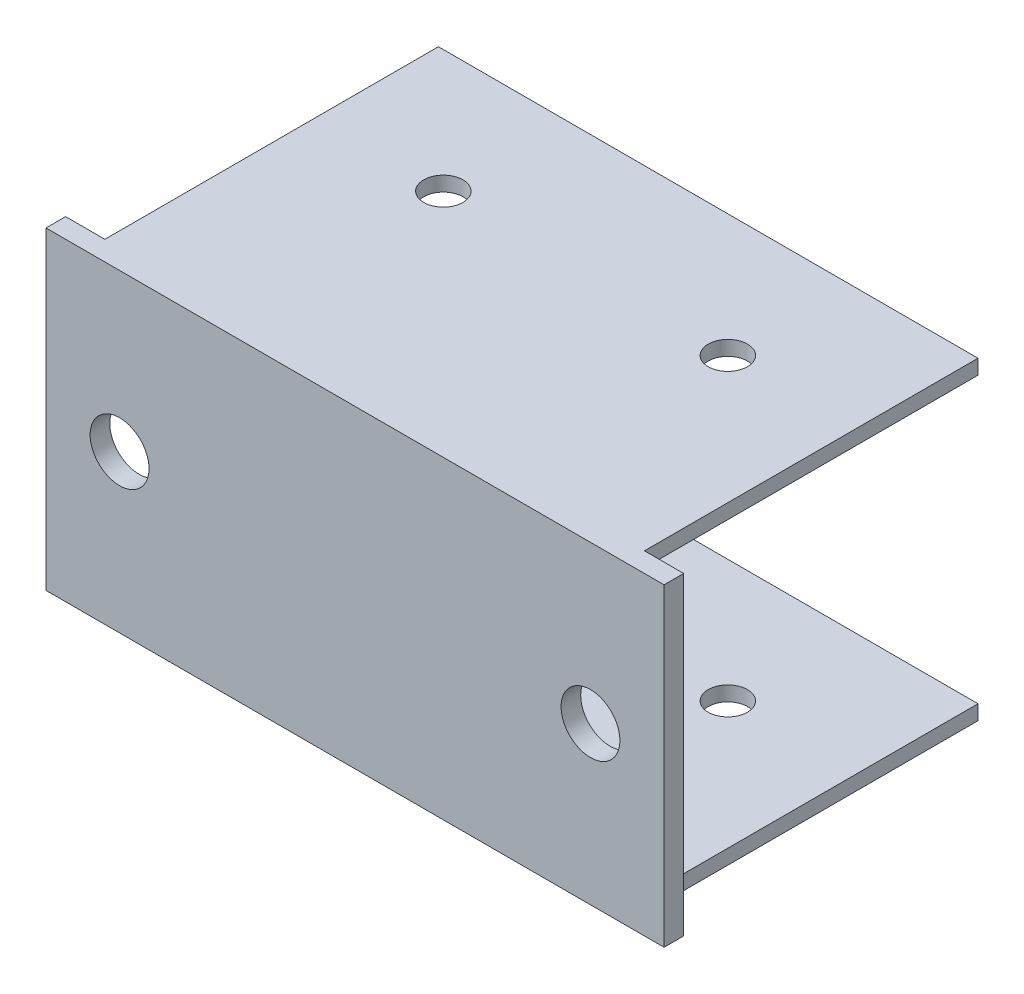
from build123d import *

# Parameters (mm, degrees)
SKETCH_1_W          = 63
SKETCH_1_H          = 32
EXTRUDE_1_DEPTH     = 2
SKETCH_2_R          = 3
CUT_EXTRUDE_1_DEPTH = 10
SKETCH_4_W          = 55
SKETCH_4_H          = 36
EXTRUDE_2_DEPTH     = 1.5
SKETCH_5_R          = 2
CUT_EXTRUDE_2_DEPTH = 57.322730758


with BuildPart() as part:
    # 草图1 → 凸台-拉伸1 (new body)
    with BuildSketch(Plane.XY):
        Rectangle(SKETCH_1_W, SKETCH_1_H)
    extrude(amount=EXTRUDE_1_DEPTH)

    # 草图2 → 切除-拉伸1 (cut)
    with BuildSketch(Plane.XY.offset(2)):
        with Locations((-24, 0)):
            Circle(SKETCH_2_R)
        with Locations((24, 0)):
            Circle(SKETCH_2_R)
    extrude(amount=-CUT_EXTRUDE_1_DEPTH, mode=Mode.SUBTRACT)

    # 草图4 → 凸台-拉伸2 (add)
    with BuildSketch(Plane(origin=(0, 16, 0), x_dir=(1, 0, 0), z_dir=(0, 1, 0))):
        with Locations((0, 16)):
            Rectangle(SKETCH_4_W, SKETCH_4_H)
    extrude_2 = extrude(amount=-EXTRUDE_2_DEPTH)

    # 草图5 → 切除-拉伸2 (cut, through all)
    with BuildSketch(Plane(origin=(0, 16, 0), x_dir=(1, 0, 0), z_dir=(0, 1, 0))):
        with Locations((-14.5, 21.5)):
            Circle(SKETCH_5_R)
        with Locations((14.5, 21.5)):
            Circle(SKETCH_5_R)
    cut_extrude_2 = extrude(amount=-CUT_EXTRUDE_2_DEPTH, mode=Mode.SUBTRACT)

    # 镜向1: 凸台-拉伸2, 切除-拉伸2 across plane
    add(extrude_2.mirror(Plane.ZX))
    add(cut_extrude_2.mirror(Plane.ZX), mode=Mode.SUBTRACT)


solid = part.part
